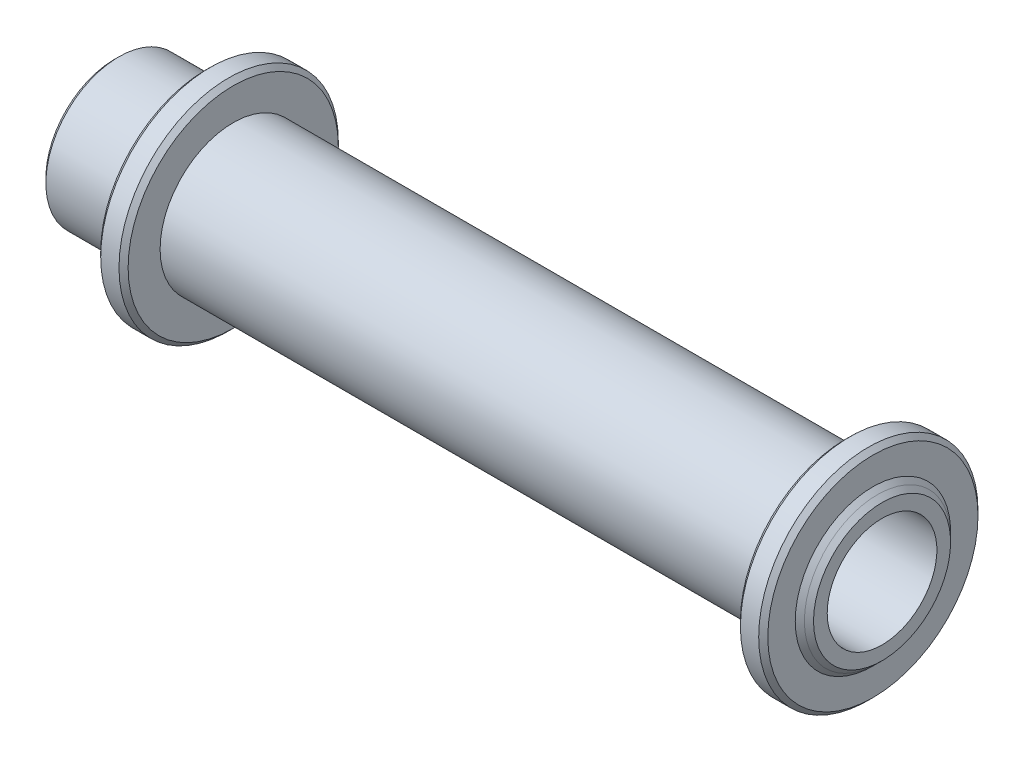
from build123d import *

# Parameters (mm, degrees)
CHAMFER1_SIZE = 0.5


with BuildPart() as part:
    # Sketch1 → Revolve1 (revolve)
    with BuildSketch(Plane.XY, mode=Mode.PRIVATE) as revolve1_sk:
        Polygon((-90.116565428, 8), (-80.116565428, 8), (-80.116565428, 12), (-77.116565428, 12), (-77.116565428, 8), (-10.116565428, 8), (-10.116565428, 12), (-7.116565428, 12), (-7.116565428, 8), (-6.116565428, 8), (-6.116565428, 6), (-90.116565428, 6), align=None)
    revolve(revolve1_sk.sketch.rotate(Axis((-123.692772778, 0, 0), (1, 0, 0)), 90), axis=Axis((-123.692772778, 0, 0), (1, 0, 0)))

    # Chamfer1
    chamfer1_edges = [part.edges().sort_by_distance(p)[0] for p in [
        (-7.116565428, 0, -12),
        (-10.116565428, 0, -12),
        (-77.116565428, 0, -12),
        (-80.116565428, 0, -12),
        (-80.116565428, 0, -8),
        (-90.116565428, 0, -8),
        (-6.116565428, 0, -8),
        (-7.116565428, 0, -8),
    ]]
    chamfer(chamfer1_edges, length=CHAMFER1_SIZE - 0.0001)  # a hair under: the kernel refuses the full size


solid = part.part
